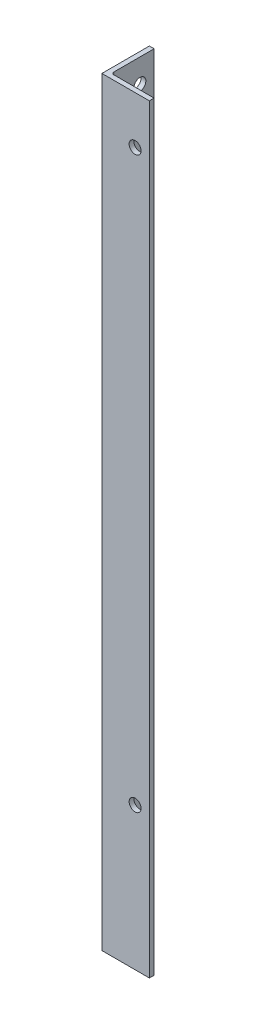
from build123d import *

# Parameters (mm, degrees)
BOSS_EXTRUDE1_DEPTH               = 508
LEFTSIDEHOLES_SKETCH3_R           = 4
BACKSIDEHOLES_CUT_EXTRUDE1_DEPTH  = 3.175
BACKSIDEHOLES_SKETCH4_R           = 4
RIGHTSIDEHOLES_CUT_EXTRUDE2_DEPTH = 3.175


with BuildPart() as part:
    # Sketch2 → Boss-Extrude1 (new body)
    with BuildSketch(Plane(origin=(0, 0, 0), x_dir=(1, 0, 0), z_dir=(0, 1, 0))):
        with BuildLine():
            Line((0, 31.75), (3.175, 31.75))
            Line((3.175, 31.75), (3.175, 4.7625))
            ThreePointArc((3.175, 4.7625), (3.639967985, 3.639967985), (4.7625, 3.175))
            Line((4.7625, 3.175), (31.75, 3.175))
            Line((31.75, 3.175), (31.75, 0))
            Line((31.75, 0), (0, 0))
            Line((0, 0), (0, 31.75))
        make_face()
    extrude(amount=BOSS_EXTRUDE1_DEPTH)

    # LeftSideHoles-Sketch3 → BackSideHoles-Cut-Extrude1 (cut)
    with BuildSketch(Plane.XY):
        with Locations((22.225, 95.4)):
            Circle(LEFTSIDEHOLES_SKETCH3_R)
        with Locations((22.225, 476.25)):
            Circle(LEFTSIDEHOLES_SKETCH3_R)
    extrude(amount=-BACKSIDEHOLES_CUT_EXTRUDE1_DEPTH, mode=Mode.SUBTRACT)

    # BackSideHoles-Sketch4 → RightSideHoles-Cut-Extrude2 (cut)
    with BuildSketch(Plane.ZY):
        with Locations((-22.225, 95.4)):
            Circle(BACKSIDEHOLES_SKETCH4_R)
        with Locations((-22.225, 492.125)):
            Circle(BACKSIDEHOLES_SKETCH4_R)
        with Locations((-22.225, 351.58487)):
            Circle(BACKSIDEHOLES_SKETCH4_R)
    extrude(amount=-RIGHTSIDEHOLES_CUT_EXTRUDE2_DEPTH, mode=Mode.SUBTRACT)


solid = part.part
